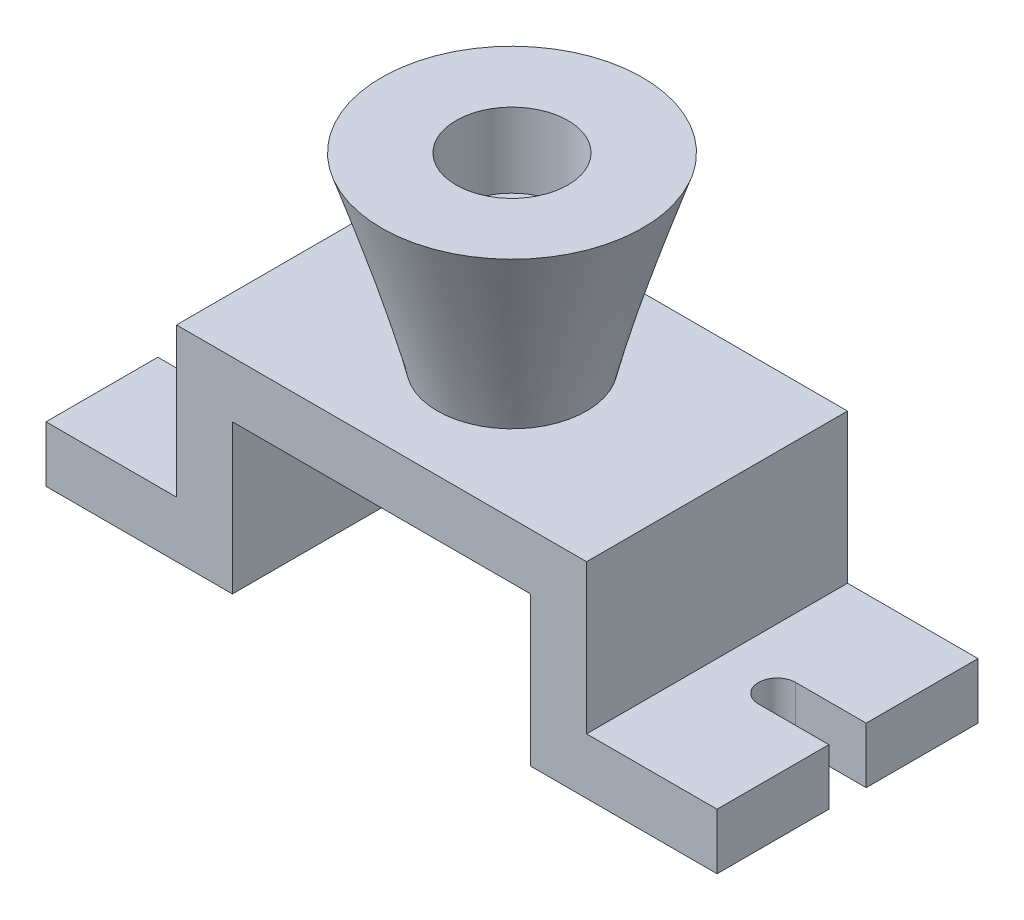
from build123d import *

# Parameters (mm, degrees)
BOSS_EXTRUDE1_DEPTH = 35
CUT_EXTRUDE1_DEPTH  = 70
SKETCH11_R          = 15
CUT_EXTRUDE2_DEPTH  = 20
SKETCH12_R          = 8
CUT_EXTRUDE3_DEPTH  = 30
CUT_EXTRUDE4_START  = -30
SKETCH13_R          = 8
CUT_EXTRUDE4_DEPTH  = 30


with BuildPart() as part:
    # Sketch1 → Boss-Extrude1 (new, symmetric)
    with BuildSketch(Plane.XY):
        Polygon((-46.019417476, 0), (-46.019417476, 40), (33.980582524, 40), (33.980582524, 0), (83.980582524, 0), (83.980582524, 15), (48.980582524, 15), (48.980582524, 55), (-61.019417476, 55), (-61.019417476, 15), (-96.019417476, 15), (-96.019417476, 0), align=None)
    extrude(amount=BOSS_EXTRUDE1_DEPTH, both=True)

    # Sketch2 → Cut-Extrude1 (cut)
    with BuildSketch(Plane(origin=(0, 15, 0), x_dir=(1, 0, 0), z_dir=(0, 1, 0))):
        with BuildLine():
            Line((65.087517656, 5), (83.980582524, 5))
            Line((83.980582524, 5), (83.980582524, -5))
            Line((83.980582524, -5), (65.087517656, -5))
            ThreePointArc((65.087517656, -5), (60.087517656, 0), (65.087517656, 5))
        make_face()
        with BuildLine():
            Line((-96.019417476, -5), (-96.019417476, 5))
            Line((-96.019417476, 5), (-77.126352608, 5))
            ThreePointArc((-77.126352608, 5), (-72.126352608, 0), (-77.126352608, -5))
            Line((-77.126352608, -5), (-96.019417476, -5))
        make_face()
    extrude(amount=-CUT_EXTRUDE1_DEPTH, mode=Mode.SUBTRACT)

    # Loft1: read off the stored shape, not the designer's step
    # Loft1: loft between two sections, ruled curve by curve
    loft1_from = [
        Edge.make_bspline([(-38.292502188, 105, 13.54429781), (-65.381097807, 105, -51.001871615), (-0.834928382, 105, -78.090467234), (26.253667237, 105, -13.54429781), (53.342262856, 105, 51.001871615), (-11.203906569, 105, 78.090467234), (-38.292502188, 105, 13.54429781)], [0, 0, 0, 0, 0.5, 0.5, 0.5, 1, 1, 1, 1], 3, [1, 0.333333333, 0.333333333, 1, 0.333333333, 0.333333333, 1]),
    ]
    loft1_to = [
        Edge.make_bspline([(-26.008227644, 55, -0.668930523), (-24.670366599, 55, -40.64655086), (15.307253739, 55, -39.308689814), (13.969392693, 55, 0.668930523), (12.631531647, 55, 40.64655086), (-27.34608869, 55, 39.308689814), (-26.008227644, 55, -0.668930523)], [0, 0, 0, 0, 0.5, 0.5, 0.5, 1, 1, 1, 1], 3, [1, 0.333333333, 0.333333333, 1, 0.333333333, 0.333333333, 1]),
    ]
    loft1 = Solid(Shell([*[Face.make_surface_from_curves(loft1_from[k], loft1_to[k]) for k in range(1)], Face(Wire(loft1_from)), Face(Wire(loft1_to))]))
    add(loft1)

    # Sketch11 → Cut-Extrude2 (cut)
    with BuildSketch(Plane(origin=(0, 105, 0), x_dir=(1, 0, 0), z_dir=(0, 1, 0))):
        with Locations(Location((-6.019417476, 0, 0), (0, 0, 270))):
            Circle(SKETCH11_R)
    extrude(amount=-CUT_EXTRUDE2_DEPTH, mode=Mode.SUBTRACT)

    # Sketch12 → Cut-Extrude3 (cut)
    with BuildSketch(Plane.XZ.offset(-40)):
        with Locations(Location((-6.019417476, 0, 0), (0, 0, 270))):
            Circle(SKETCH12_R)
    extrude(amount=-CUT_EXTRUDE3_DEPTH, mode=Mode.SUBTRACT)

    # Sketch13 → Cut-Extrude4 (cut)
    with BuildSketch(Plane(origin=(0, 85, 0), x_dir=(1, 0, 0), z_dir=(0, 1, 0)).offset(CUT_EXTRUDE4_START)):
        with Locations(Location((-6.019417476, 0, 0), (0, 0, 90))):
            Circle(SKETCH13_R)
    extrude(amount=CUT_EXTRUDE4_DEPTH, mode=Mode.SUBTRACT)


solid = part.part
